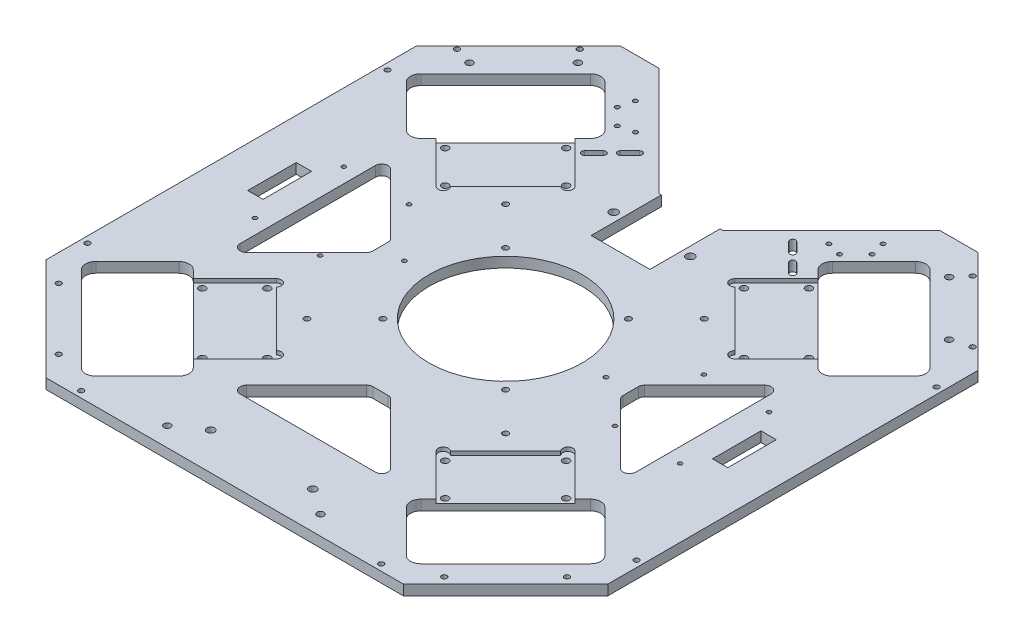
from build123d import *

# Parameters (mm, degrees)
SKETCH_1_W                       = 440
SKETCH_1_H                       = 450
EXTRUDE_1_DEPTH                  = 4
CUT_EXTRUDE_2155_DEPTH           = 319.377134857
CUT_EXTRUDE_2155_DEPTH_BACK      = 319.377134857
SKETCH_5_W                       = 46
SKETCH_5_H                       = 140
CUT_EXTRUDE_2832_DEPTH           = 319.377134857
CUT_EXTRUDE_3542_DEPTH           = 319.377134857
FILLET_1_R                       = 8
CUT_EXTRUDE_4382_DEPTH           = 3
SKETCH_27_R                      = 4
CUT_EXTRUDE_1_DEPTH              = 3
HOLE_WIZARD_M5_2_D               = 5.3
HOLE_WIZARD_M4_1_D               = 4.5
PATTERN_CIRCULAR_1_COUNT         = 4
FILLET_1_OF_PATTERN_CIRCULAR_1_R = 8
CHAMFER_1_SIZE                   = 80
HOLE_WIZARD_M5_1_D               = 5.3
HOLE_WIZARD_1_AT_2_COUNT         = 2
HOLE_WIZARD_1_AT_2_PITCH         = 18
HOLE_WIZARD_1_AT_3_COUNT         = 2
HOLE_WIZARD_1_AT_3_PITCH         = 11.66190379
HOLE_WIZARD_1_AT_4_COUNT         = 2
HOLE_WIZARD_1_AT_4_PITCH         = 26
HOLE_WIZARD_M6_1_D               = 6.4
HOLE_START                       = -4
HOLE_WIZARD_M4_3_DEPTH           = 8
HOLE_WIZARD_M4_2_D               = 4.1
CUT_EXTRUDE_3_REACH              = 320.377
SKETCH_36_R                      = 60
CUT_EXTRUDE_4_REACH              = 320.377
FILLET_2_R                       = 5
PATTERN_CIRCULAR_2_COUNT         = 3
PATTERN_CIRCULAR_2_ANGLE         = 180
FILLET_2_OF_PATTERN_CIRCULAR_2_R = 5
HOLE_WIZARD_M4_1_2_D             = 3.3
HOLE_WIZARD_6_0_6_1_D            = 6
SKETCH_45_W                      = 12
SKETCH_45_H                      = 38
CUT_EXTRUDE_6_DEPTH              = 10
HOLE_WIZARD_M3_1_D               = 3.2


# Read off the part's stored shape, not the designer's step: M4 间隙槽口3
with BuildPart() as part:
    # 草图1 → 凸台-拉伸1 (new, symmetric)
    with BuildSketch(Plane(origin=(0, 0, 0), x_dir=(1, 0, 0), z_dir=(0, 1, 0))):
        with Locations((0, 5)):
            Rectangle(SKETCH_1_W, SKETCH_1_H)
    extrude(amount=EXTRUDE_1_DEPTH, both=True)

    # 草图3 → Cut-Extrude 2155 (cut, two sides: drawn at the far end of the back side and taken through both)
    with BuildSketch(Plane(origin=(0, 4, 0), x_dir=(1, 0, 0), z_dir=(0, 1, 0)).offset(-CUT_EXTRUDE_2155_DEPTH_BACK)):
        Polygon((25, 145), (110, 230), (-110, 230), (-25, 145), align=None)
    extrude(amount=CUT_EXTRUDE_2155_DEPTH + CUT_EXTRUDE_2155_DEPTH_BACK, mode=Mode.SUBTRACT)

    # 草图5 → Cut-Extrude 2832 (cut, through all)
    with BuildSketch(Plane(origin=(0, 4, 0), x_dir=(1, 0, 0), z_dir=(0, 1, 0))):
        with Locations((0, 160)):
            Rectangle(SKETCH_5_W, SKETCH_5_H)
    extrude(amount=-CUT_EXTRUDE_2832_DEPTH, mode=Mode.SUBTRACT)

    # 草图4 → Cut-Extrude 3542 (cut, through all)
    with BuildSketch(Plane(origin=(0, 4, 0), x_dir=(1, 0, 0), z_dir=(0, 1, 0))):
        Polygon((83.43860018, -161.220346111), (161.220346111, -83.43860018), (205.060966544, -127.279220614), (127.279220614, -205.060966544), align=None)
    cut_extrude_3542 = extrude(amount=-CUT_EXTRUDE_3542_DEPTH, mode=Mode.SUBTRACT)

    # 圆角1
    fillet_1_edges = [part.edges().sort_by_distance(p)[0] for p in [
        (127.279220614, 0, 205.060966544),
        (83.43860018, 0, 161.220346111),
        (161.220346111, 0, 83.43860018),
        (205.060966544, 0, 127.279220614),
    ]]
    fillet(fillet_1_edges, radius=FILLET_1_R)

    # 草图7 → Cut-Extrude 4382 (cut)
    with BuildSketch(Plane(origin=(0, 4, 0), x_dir=(1, 0, 0), z_dir=(0, 1, 0))):
        Polygon((95.10586207, -149.553084221), (149.553084221, -95.10586207), (117.026172286, -62.578950135), (62.578950135, -117.026172286), align=None)
    cut_extrude_4382 = extrude(amount=-CUT_EXTRUDE_4382_DEPTH, mode=Mode.SUBTRACT)

    # 草图27 → 切除-拉伸1 (cut)
    with BuildSketch(Plane(origin=(0, 4, 0), x_dir=(1, 0, 0), z_dir=(0, 1, 0))):
        with Locations((114.197745162, -65.40737726)):
            Circle(SKETCH_27_R)
        with Locations((65.40737726, -114.197745162)):
            Circle(SKETCH_27_R)
    cut_extrude_1 = extrude(amount=-CUT_EXTRUDE_1_DEPTH, mode=Mode.SUBTRACT)

    # M5 间隙孔2 (through all)
    with Locations(Plane.XZ.offset(4)):
        with Locations((117.026172286, 69.650017947), (142.482016409, 95.10586207), (69.650017947, 117.026172286), (95.10586207, 142.482016409)):
            hole_wizard_m5_2 = Hole(HOLE_WIZARD_M5_2_D / 2)

    # Hole Wizard M4 _1 (through all)
    with Locations(Plane(origin=(0, 4, 0), x_dir=(1, 0, 0), z_dir=(0, 1, 0))):
        with Locations((77.781745931, -77.781745931), (48.083261121, -48.083261121)):
            hole_wizard_m4_1 = Hole(HOLE_WIZARD_M4_1_D / 2)

    # 阵列(圆周)1: Cut-Extrude 3542, Cut-Extrude 4382, 切除-拉伸1, M5 间隙孔2, Hole Wizard M4 _1 ×4 about axis
    pattern_circular_1_axis = Axis((0, 0, 0), (0, 1, 0))
    add([cut_extrude_3542.rotate(pattern_circular_1_axis, i * 360 / PATTERN_CIRCULAR_1_COUNT) for i in range(1, PATTERN_CIRCULAR_1_COUNT)], mode=Mode.SUBTRACT)
    add([cut_extrude_4382.rotate(pattern_circular_1_axis, i * 360 / PATTERN_CIRCULAR_1_COUNT) for i in range(1, PATTERN_CIRCULAR_1_COUNT)], mode=Mode.SUBTRACT)
    add([cut_extrude_1.rotate(pattern_circular_1_axis, i * 360 / PATTERN_CIRCULAR_1_COUNT) for i in range(1, PATTERN_CIRCULAR_1_COUNT)], mode=Mode.SUBTRACT)
    add([hole_wizard_m5_2.rotate(pattern_circular_1_axis, i * 360 / PATTERN_CIRCULAR_1_COUNT) for i in range(1, PATTERN_CIRCULAR_1_COUNT)], mode=Mode.SUBTRACT)
    add([hole_wizard_m4_1.rotate(pattern_circular_1_axis, i * 360 / PATTERN_CIRCULAR_1_COUNT) for i in range(1, PATTERN_CIRCULAR_1_COUNT)], mode=Mode.SUBTRACT)

    # 圆角1 of 阵列(圆周)1
    fillet_1_of_pattern_circular_1_edges = [part.edges().sort_by_distance(p)[0] for p in [
        (205.060966544, 0, -127.279220614),
        (161.220346111, 0, -83.43860018),
        (83.43860018, 0, -161.220346111),
        (127.279220614, 0, -205.060966544),
        (-127.279220614, 0, -205.060966544),
        (-83.43860018, 0, -161.220346111),
        (-161.220346111, 0, -83.43860018),
        (-205.060966544, 0, -127.279220614),
        (-205.060966544, 0, 127.279220614),
        (-161.220346111, 0, 83.43860018),
        (-83.43860018, 0, 161.220346111),
        (-127.279220614, 0, 205.060966544),
    ]]
    fillet(fillet_1_of_pattern_circular_1_edges, radius=FILLET_1_OF_PATTERN_CIRCULAR_1_R)

    # 倒角1
    chamfer_1_edges = [part.edges().sort_by_distance(p)[0] for p in [
        (220, 0, 220),
        (-220, 0, 220),
        (-220, 0, -230),
        (220, 0, -230),
    ]]
    chamfer(chamfer_1_edges, length=CHAMFER_1_SIZE)

    # M5 间隙孔1 (through all)
    with Locations(Plane(origin=(0, 4, 0), x_dir=(1, 0, 0), z_dir=(0, 1, 0))):
        with Locations((60, -205), (-60, -205), (145.402020254, 201.970562748), (187.828427125, 159.544155877), (-187.828427125, 159.544155877), (-145.402020254, 201.970562748)):
            Hole(HOLE_WIZARD_M5_1_D / 2)

    # 草图21 → 打孔尺寸(%根据十字)槽半沉头木螺钉的类型1 (revolve, cut)
    with BuildSketch(Plane(origin=(-99.806132548, -4, -187.279220614), x_dir=(0, 0, -1), z_dir=(1, 0, 0))):
        Polygon((0, 0), (0, 11.021463052), (1.7, 10), (1.7, 1.6), (3.3, 0), align=None)
    hole_wizard_1 = revolve(axis=Axis((-99.806132548, -10.35, -187.279220614), (0, 1, 0)), mode=Mode.SUBTRACT)

    # 打孔尺寸(%根据十字)槽半沉头木螺钉的类型1 at 2: 打孔尺寸(%根据十字)槽半沉头木螺钉的类型1 ×2
    with Locations(*[Vector(0.7071067811865476, 0, 0.7071067811865476) * (i * HOLE_WIZARD_1_AT_2_PITCH) for i in range(1, HOLE_WIZARD_1_AT_2_COUNT)]):
        add(hole_wizard_1, mode=Mode.SUBTRACT)

    # 打孔尺寸(%根据十字)槽半沉头木螺钉的类型1 at 3: 打孔尺寸(%根据十字)槽半沉头木螺钉的类型1 ×2
    with Locations(*[Vector(0.24253562503633644, 0, -0.9701425001453311) * (i * HOLE_WIZARD_1_AT_3_PITCH) for i in range(1, HOLE_WIZARD_1_AT_3_COUNT)]):
        add(hole_wizard_1, mode=Mode.SUBTRACT)

    # 打孔尺寸(%根据十字)槽半沉头木螺钉的类型1 at 4: 打孔尺寸(%根据十字)槽半沉头木螺钉的类型1 ×2
    with Locations(*[Vector(0.9246780984747163, 0, 0.38074980525429414) * (i * HOLE_WIZARD_1_AT_4_PITCH) for i in range(1, HOLE_WIZARD_1_AT_4_COUNT)]):
        add(hole_wizard_1, mode=Mode.SUBTRACT)

    # M6 间隙孔1 (through all)
    with Locations(Plane(origin=(0, -4, 0), x_dir=(-1, 0, 0), z_dir=(0, -1, 0))):
        with Locations((30, 114.64447644), (-30, 114.64447644)):
            Hole(HOLE_WIZARD_M6_1_D / 2)

    # M4 间隙槽口3 outline → M4 间隙槽口3 (cut)
    with BuildSketch(Plane(origin=(0, 0, 0), x_dir=(1, 0, 0), z_dir=(0, 1, 0)).offset(HOLE_START)):
        with BuildLine():
            ThreePointArc((-58.440385849, 163.237590053), (-58.440385849, 166.419570569), (-61.622366364, 166.419570569))
            Line((-61.622366364, 166.419570569), (-69.046987567, 158.994949366))
            ThreePointArc((-69.046987567, 158.994949366), (-69.046987566, 155.81296885), (-65.865007051, 155.812968851))
            Line((-65.865007051, 155.812968851), (-58.440385849, 163.237590053))
        make_face()
        with BuildLine():
            ThreePointArc((-83.18912319, 144.852813742), (-83.18912319, 141.670833227), (-80.007142675, 141.670833227))
            Line((-80.007142675, 141.670833227), (-72.582521472, 149.09545443))
            ThreePointArc((-72.582521472, 149.09545443), (-72.582521472, 152.277434946), (-75.764501988, 152.277434945))
            Line((-75.764501988, 152.277434945), (-83.18912319, 144.852813742))
        make_face()
    hole_wizard_m4_3 = extrude(amount=HOLE_WIZARD_M4_3_DEPTH, mode=Mode.SUBTRACT)

    # M4 间隙孔2 (through all)
    with Locations(Plane(origin=(0, 4, 0), x_dir=(1, 0, 0), z_dir=(0, 1, 0))):
        with Locations((-153.837049096, 211.920310217), (-201.920310217, 163.837049096), (-151.008621971, -199.091883092), (-199.091883092, -151.008621971), (-215, 122.5), (-215, -112.5), (-117.5, -215)):
            hole_wizard_m4_2 = Hole(HOLE_WIZARD_M4_2_D / 2)

    # 镜向1: 打孔尺寸(%根据十字)槽半沉头木螺钉的类型1, M4 间隙槽口3, M4 间隙孔2 across plane
    add(hole_wizard_1.mirror(Plane(origin=(0, 0, 0), x_dir=(0, 0, 1), z_dir=(1, 0, 0))), mode=Mode.SUBTRACT)
    add(hole_wizard_m4_3.mirror(Plane(origin=(0, 0, 0), x_dir=(0, 0, 1), z_dir=(1, 0, 0))), mode=Mode.SUBTRACT)
    add(hole_wizard_m4_2.mirror(Plane(origin=(0, 0, 0), x_dir=(0, 0, 1), z_dir=(1, 0, 0))), mode=Mode.SUBTRACT)

    # 镜向1 copy 1 sketch → 镜向1 copy 1 (revolve, cut)
    with BuildSketch(Plane(origin=(87.078210487, -4, -174.551298552), x_dir=(0, 0, -1), z_dir=(-1, 0, 0))):
        Polygon((0, 0), (0, -11.021463052), (1.7, -10), (1.7, -1.6), (3.3, 0), align=None)
    revolve(axis=Axis((87.078210487, -10.35, -174.551298552), (0, -1, 0)), mode=Mode.SUBTRACT)

    # 镜向1 copy 2 sketch → 镜向1 copy 2 (revolve, cut)
    with BuildSketch(Plane(origin=(96.977705423, -4, -198.592929113), x_dir=(0, 0, -1), z_dir=(-1, 0, 0))):
        Polygon((0, 0), (0, -11.021463052), (1.7, -10), (1.7, -1.6), (3.3, 0), align=None)
    revolve(axis=Axis((96.977705423, -10.35, -198.592929113), (0, -1, 0)), mode=Mode.SUBTRACT)

    # 镜向1 copy 3 sketch → 镜向1 copy 3 (revolve, cut)
    with BuildSketch(Plane(origin=(75.764501988, -4, -177.379725677), x_dir=(0, 0, -1), z_dir=(-1, 0, 0))):
        Polygon((0, 0), (0, -11.021463052), (1.7, -10), (1.7, -1.6), (3.3, 0), align=None)
    revolve(axis=Axis((75.764501988, -10.35, -177.379725677), (0, -1, 0)), mode=Mode.SUBTRACT)

    # 草图36 → 切除-拉伸3 (cut, up to next)
    with BuildSketch(Plane(origin=(0, 4, 0), x_dir=(1, 0, 0), z_dir=(0, 1, 0)), mode=Mode.PRIVATE) as cut_extrude_3_sk1:
        with Locations(Location((0, 0, 0), (0, 0, 270))):
            Circle(SKETCH_36_R)
    cut_extrude_3_tool1 = extrude(cut_extrude_3_sk1.sketch, amount=-CUT_EXTRUDE_3_REACH, mode=Mode.PRIVATE) & part.part
    add(cut_extrude_3_tool1.solids().sort_by_distance((0, 4, 0))[0], mode=Mode.SUBTRACT)

    # 草图37 → 切除-拉伸4 (cut, up to next)
    with BuildSketch(Plane.XZ.offset(4), mode=Mode.PRIVATE) as cut_extrude_4_sk1:
        Polygon((98, 8), (155, 65), (155, -65), (98, -8), align=None)
    cut_extrude_4_tool1 = extrude(cut_extrude_4_sk1.sketch, amount=-CUT_EXTRUDE_4_REACH, mode=Mode.PRIVATE) & part.part
    cut_extrude_4 = cut_extrude_4_tool1.solids().sort_by_distance((133.917808, -4, 0))[0]
    add(cut_extrude_4, mode=Mode.SUBTRACT)

    # 圆角2
    fillet_2_edges = [part.edges().sort_by_distance(p)[0] for p in [
        (98, 0, -8),
        (98, 0, 8),
        (155, 0, 65),
        (155, 0, -65),
    ]]
    fillet(fillet_2_edges, radius=FILLET_2_R)

    # 阵列(圆周)2: 切除-拉伸4 ×3 about axis
    pattern_circular_2_axis = Axis((0, 0, 0), (0, -1, 0))
    for i in range(1, PATTERN_CIRCULAR_2_COUNT):
        add(cut_extrude_4.rotate(pattern_circular_2_axis, i * PATTERN_CIRCULAR_2_ANGLE / (PATTERN_CIRCULAR_2_COUNT - 1)), mode=Mode.SUBTRACT)

    # 圆角2 of 阵列(圆周)2
    fillet_2_of_pattern_circular_2_edges = [part.edges().sort_by_distance(p)[0] for p in [
        (8, 0, 98),
        (-8, 0, 98),
        (-65, 0, 155),
        (65, 0, 155),
        (-98, 0, 8),
        (-98, 0, -8),
        (-155, 0, -65),
        (-155, 0, 65),
    ]]
    fillet(fillet_2_of_pattern_circular_2_edges, radius=FILLET_2_OF_PATTERN_CIRCULAR_2_R)

    # Hole Wizard M4 _1 2 (through all)
    with Locations(Plane(origin=(0, 4, 0), x_dir=(1, 0, 0), z_dir=(0, 1, 0))):
        with Locations((-79, -0.34), (79, -0.34)):
            Hole(HOLE_WIZARD_M4_1_2_D / 2)

    # Ø6.0 (6) 直径孔1 (through all)
    with Locations(Plane(origin=(0, 4, 0), x_dir=(1, 0, 0), z_dir=(0, 1, 0))):
        with Locations((40, -191), (-40, -191)):
            Hole(HOLE_WIZARD_6_0_6_1_D / 2)

    # 草图45 → 切除-拉伸6 (cut)
    with BuildSketch(Plane.XZ.offset(4)):
        with Locations((182, -5)):
            Rectangle(SKETCH_45_W, SKETCH_45_H)
        with Locations((-182, -5)):
            Rectangle(SKETCH_45_W, SKETCH_45_H)
    extrude(amount=-CUT_EXTRUDE_6_DEPTH, mode=Mode.SUBTRACT)

    # M3 间隙孔1 (through all)
    with Locations(Plane(origin=(0, -4, 0), x_dir=(-1, 0, 0), z_dir=(0, -1, 0))):
        with Locations((166.5, 39.8), (115.5, -29.8), (115.5, 39.8), (166.5, -29.8)):
            hole_wizard_m3_1 = Hole(HOLE_WIZARD_M3_1_D / 2)

    # 镜向2: M3 间隙孔1 across plane
    add(hole_wizard_m3_1.mirror(Plane(origin=(0, 0, 0), x_dir=(0, 0, 1), z_dir=(1, 0, 0))), mode=Mode.SUBTRACT)


solid = part.part
